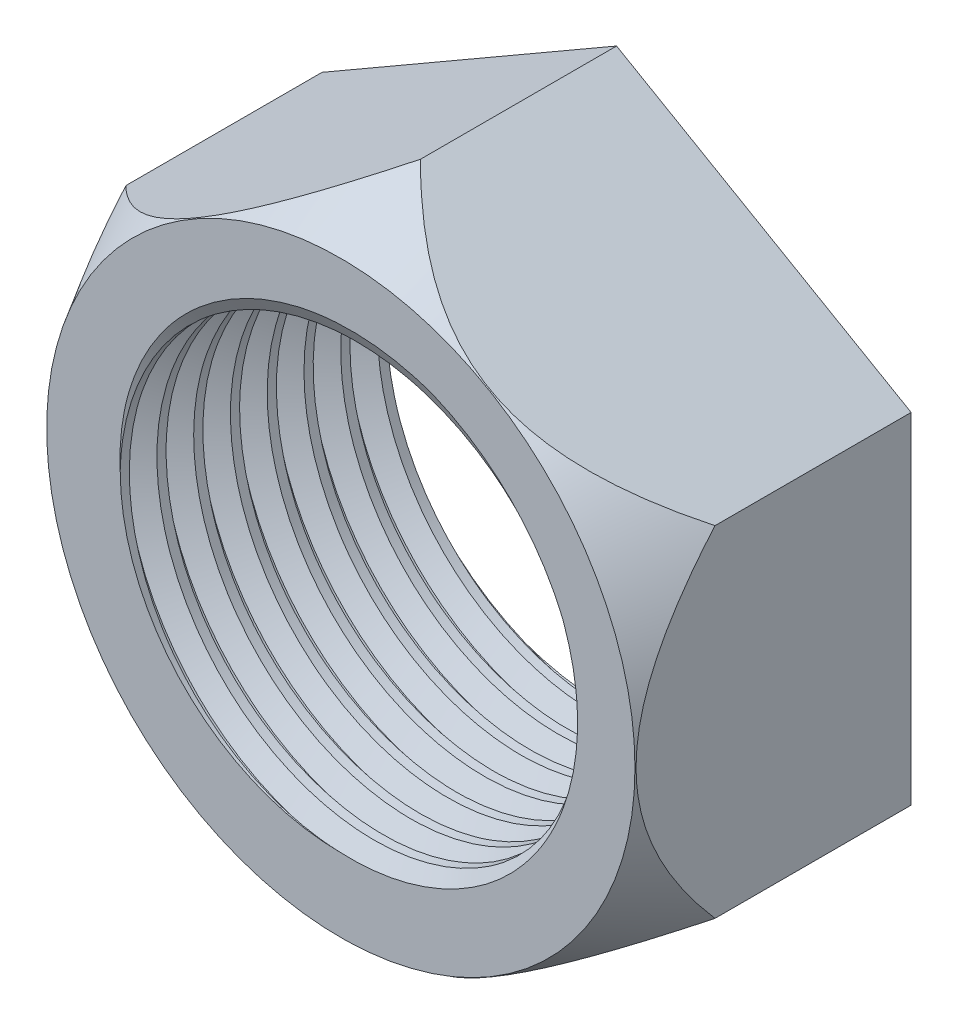
from build123d import *

# Parameters (mm, degrees)
BOSS_EXTRUDE1_DEPTH = 7.5
SKETCH3_OUTSIDE_W   = 61.602
SKETCH3_OUTSIDE_H   = 66.56
SKETCH3_OUTSIDE_R   = 16
CUT_EXTRUDE1_DEPTH  = 15
CUT_EXTRUDE1_DRAFT  = -30
SKETCH4_R           = 12
CUT_EXTRUDE2_DEPTH  = 15
THREAD2_PITCH       = 2


with BuildPart() as part:
    # Sketch2 → Boss-Extrude1 (new, symmetric)
    with BuildSketch(Plane.XY):
        Polygon((0, -18.5), (16.02146997, -9.25), (16.02146997, 9.25), (0, 18.5), (-16.02146997, 9.25), (-16.02146997, -9.25), align=None)
    extrude(amount=BOSS_EXTRUDE1_DEPTH, both=True)


with BuildPart() as cut_extrude1_tool:
    # Sketch3 outside → Cut-Extrude1 (with draft: the straight prism first)
    with BuildSketch(Plane.XY.offset(7.5)):
        Rectangle(SKETCH3_OUTSIDE_W, SKETCH3_OUTSIDE_H)
        Circle(SKETCH3_OUTSIDE_R, mode=Mode.SUBTRACT)
    extrude(amount=-CUT_EXTRUDE1_DEPTH)
    # Cut-Extrude1: the draft: its side faces are tilted about the plane it starts from
    cut_extrude1_sides = [cut_extrude1_tool.faces().sort_by_distance(p)[0] for p in [
        (0, -33.28, 0),
        (30.801, 0, 0),
        (0, 33.28, 0),
        (-30.801, 0, 0),
        (-16, 0, 0),
    ]]
    draft(cut_extrude1_sides, Plane.XY.offset(7.5), CUT_EXTRUDE1_DRAFT)


with BuildPart() as part_1:
    add(part.part)

    # Cut-Extrude1: cut by cut_extrude1_tool
    add(cut_extrude1_tool.part, mode=Mode.SUBTRACT)

    # Sketch4 → Cut-Extrude2 (cut)
    with BuildSketch(Plane.XY.offset(7.5)):
        Circle(SKETCH4_R)
    extrude(amount=-CUT_EXTRUDE2_DEPTH, mode=Mode.SUBTRACT)

    # Thread2: the profile of Thread Profile3 profile screwed along a right-hand helix of 8.5 turns, 10 arcs to a turn; built about Z, then put on its axis
    thread2_z = Axis((0, 0, 0), (0, 0, 1))
    thread2_corners = [(11.9997, 0, -0.000173205), (13.08253175, 0, 0.624999997), (13.08253175, 0, 0.874999997), (11.9997, 0, 1.5001732)]
    with BuildLine(mode=Mode.PRIVATE) as thread2_profile:
        Line(thread2_corners[0], thread2_corners[1])
        Line(thread2_corners[1], thread2_corners[2])
        Line(thread2_corners[2], thread2_corners[3])
        Line(thread2_corners[3], thread2_corners[0])
    thread2_cap = Face(thread2_profile.wire())
    thread2_turn_angles = [0, 18, 36, 54, 72, 90, 108, 126, 144, 162, 180, 198, 216, 234, 252, 270, 288, 306, 324, 342, 360]
    thread2_turn_weights = [1, 0.9510565162951535, 1, 0.9510565162951535, 1, 0.9510565162951535, 1, 0.9510565162951535, 1, 0.9510565162951535, 1, 0.9510565162951535, 1, 0.9510565162951535, 1, 0.9510565162951535, 1, 0.9510565162951535, 1, 0.9510565162951535, 1]
    thread2_turn_rails = [Edge.make_bspline([Vector(p[0], p[1], 0).rotate(thread2_z, thread2_turn_angles[k]) / thread2_turn_weights[k] + Vector(0, 0, p[2] + THREAD2_PITCH * thread2_turn_angles[k] / 360) for k in range(21)], [0, 0, 0, 1, 1, 2, 2, 3, 3, 4, 4, 5, 5, 6, 6, 7, 7, 8, 8, 9, 9, 10, 10, 10], 2, thread2_turn_weights) for p in thread2_corners]
    thread2_turn_sides = [Face.make_surface_from_curves(thread2_turn_rails[p[0]], thread2_turn_rails[p[1]]) for p in [(0, 1), (1, 2), (2, 3), (3, 0)]]
    thread2_last_angles = [2880, 2898, 2916, 2934, 2952, 2970, 2988, 3006, 3024, 3042, 3060]
    thread2_last_weights = [1, 0.9510565162951535, 1, 0.9510565162951535, 1, 0.9510565162951535, 1, 0.9510565162951535, 1, 0.9510565162951535, 1]
    thread2_last_rails = [Edge.make_bspline([Vector(p[0], p[1], 0).rotate(thread2_z, thread2_last_angles[k]) / thread2_last_weights[k] + Vector(0, 0, p[2] + THREAD2_PITCH * thread2_last_angles[k] / 360) for k in range(11)], [0, 0, 0, 1, 1, 2, 2, 3, 3, 4, 4, 5, 5, 5], 2, thread2_last_weights) for p in thread2_corners]
    thread2_last_sides = [Face.make_surface_from_curves(thread2_last_rails[p[0]], thread2_last_rails[p[1]]) for p in [(0, 1), (1, 2), (2, 3), (3, 0)]]
    thread2 = Plane(origin=(0, 0, -9.5), x_dir=(1, 0, 0), z_dir=(0, 0, 1)) * Solid(Shell([*[p.moved(Location((0, 0, THREAD2_PITCH * i))) for i in range(8) for p in thread2_turn_sides], *thread2_last_sides, thread2_cap, thread2_cap.rotate(thread2_z, 3060).moved(Location((0, 0, THREAD2_PITCH * 3060 / 360)))]))
    add(thread2, mode=Mode.SUBTRACT)


solid = part_1.part
